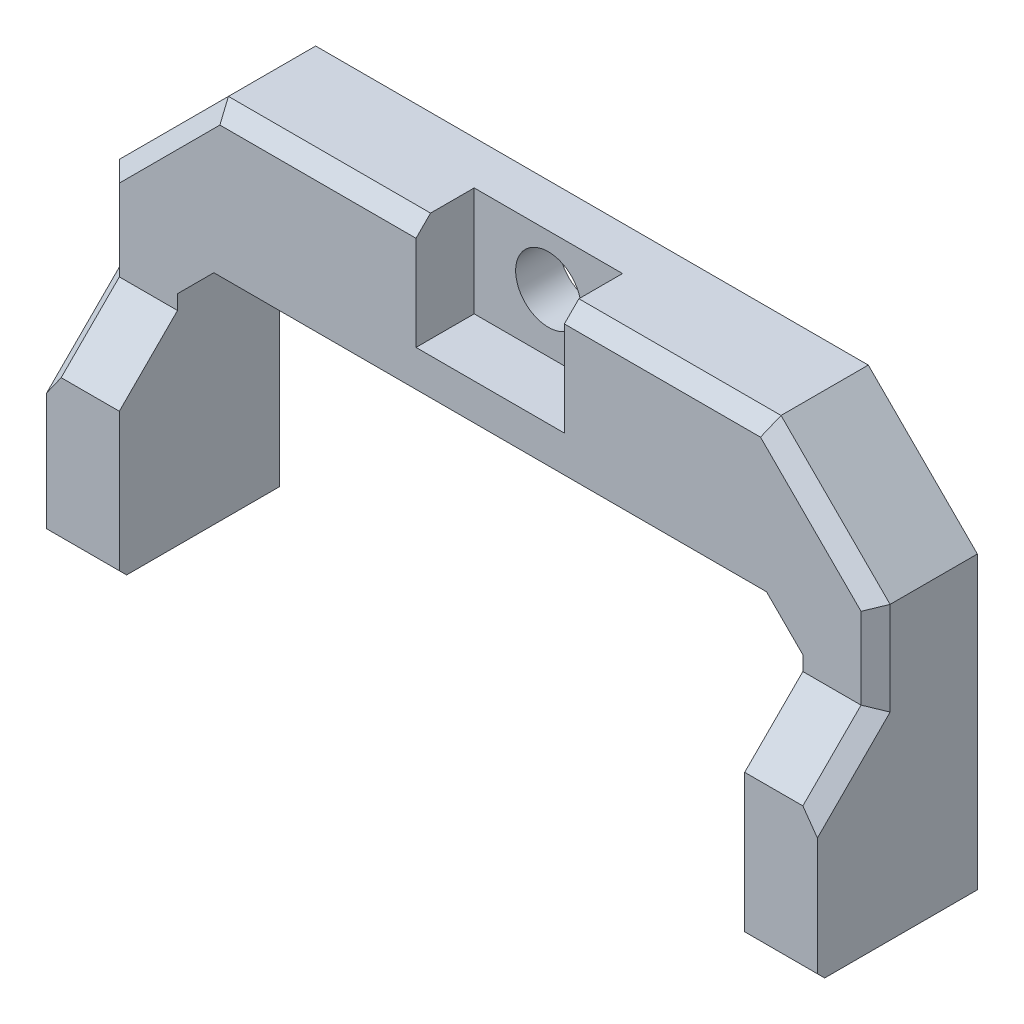
from build123d import *

# Parameters (mm, degrees)
BOSS_EXTRUDE1_DEPTH  = 7
SKETCH6_W            = 5
SKETCH6_H            = 10
BOSS_EXTRUDE2_DEPTH  = 4
SKETCH3_W            = 5.1
SKETCH3_H            = 7.5
CUT_EXTRUDE1_DEPTH   = 4
M4_CLEARANCE_HOLE1_D = 4.5
CHAMFER2_SIZE        = 4
CHAMFER5_SIZE        = 0.5


# Some blends are built 0.0001 mm under size
with BuildPart() as part:
    # Sketch1 → Boss-Extrude1 (new body)
    with BuildSketch(Plane.XY):
        Polygon((0, 0), (0, -10), (-19, -10), (-21.5, -12.5), (-21.5, -27.5), (-26.5, -27.5), (-26.5, -7.5), (-19, 0), align=None)
    boss_extrude1 = extrude(amount=BOSS_EXTRUDE1_DEPTH)

    # Sketch6 → Boss-Extrude2 (add)
    with BuildSketch(Plane.XY.offset(7)):
        with Locations((-24, -22.5)):
            Rectangle(SKETCH6_W, SKETCH6_H)
    boss_extrude2 = extrude(amount=BOSS_EXTRUDE2_DEPTH)

    # Sketch3 → Cut-Extrude1 (cut)
    with BuildSketch(Plane.XY.offset(7)):
        with Locations((-2.55, -3.75)):
            Rectangle(SKETCH3_W, SKETCH3_H)
    cut_extrude1 = extrude(amount=-CUT_EXTRUDE1_DEPTH, mode=Mode.SUBTRACT)

    # Mirror1: Boss-Extrude1, Boss-Extrude2, Cut-Extrude1 across plane
    add(boss_extrude1.mirror(Plane(origin=(0, 0, 7), x_dir=(0, 0, 1), z_dir=(-1, 0, 0))))
    add(boss_extrude2.mirror(Plane(origin=(0, 0, 7), x_dir=(0, 0, 1), z_dir=(-1, 0, 0))))
    add(cut_extrude1.mirror(Plane(origin=(0, 0, 7), x_dir=(0, 0, 1), z_dir=(-1, 0, 0))), mode=Mode.SUBTRACT)

    # M4 Clearance Hole1 (through all)
    with Locations(Plane.XY.offset(3)):
        with Locations((0, -3.5)):
            Hole(M4_CLEARANCE_HOLE1_D / 2)

    # Chamfer2
    chamfer2_edges = [part.edges().sort_by_distance(p)[0] for p in [
        (-24, -17.5, 7),
        (24, -17.5, 7),
    ]]
    chamfer(chamfer2_edges, length=CHAMFER2_SIZE - 0.0001)  # a hair under: the kernel refuses the full size

    # Chamfer4
    # the kernel refuses this chamfer: 1 mm, written as the material it takes off along each edge
    with BuildSketch(Plane(origin=(26.5, -11.68164552, 5.18154552), x_dir=(-0.9996219169112968, 0.019442520806014118, 0.01944252080601436), z_dir=(0, -0.7071067811865476, 0.7071067811865476))) as chamfer4_piece_1_section:
        with BuildLine():
            Line((1.028673195, 0), (-0.056547155, 1.027117794))
            Line((-0.056547155, 1.027117794), (-0.076539593, 1.026567876))
            ThreePointArc((-0.076539593, 1.026567876), (-0.034129227, 0.51339783), (-0.019992438, -0.000549918))
            Line((-0.019992438, -0.000549918), (0.000549918, -0.019992438))
            ThreePointArc((0.000549918, -0.019992438), (0.514497665, -0.00585565), (1.029223113, -0.019992438))
            Line((1.029223113, -0.019992438), (1.028673195, 0))
        make_face()
    chamfer4_piece_1 = extrude(amount=10.800078804, mode=Mode.PRIVATE)
    chamfer4_piece_1 = split(chamfer4_piece_1, bisect_by=Plane(origin=(26.156619069, -15.715277747, 7), z_dir=(0, 0, 1)), keep=Keep.TOP, mode=Mode.PRIVATE)
    add(chamfer4_piece_1, mode=Mode.SUBTRACT)
    with BuildSketch(Plane(origin=(-26.5, -11.68164552, 5.18154552), x_dir=(0.9996219169112968, 0.019442520806013806, 0.019442520806013806), z_dir=(0, -0.7071067811865476, 0.7071067811865476))) as chamfer4_piece_2_section:
        with BuildLine():
            Line((1.028673195, 0), (-0.056547155, -1.027117794))
            Line((-0.056547155, -1.027117794), (-0.076539593, -1.026567876))
            ThreePointArc((-0.076539593, -1.026567876), (-0.034129227, -0.51339783), (-0.019992438, 0.000549918))
            Line((-0.019992438, 0.000549918), (0.000549918, 0.019992438))
            ThreePointArc((0.000549918, 0.019992438), (0.514497665, 0.00585565), (1.029223113, 0.019992438))
            Line((1.029223113, 0.019992438), (1.028673195, 0))
        make_face()
    chamfer4_piece_2 = extrude(amount=10.800078804, mode=Mode.PRIVATE)
    chamfer4_piece_2 = split(chamfer4_piece_2, bisect_by=Plane(origin=(-26.156619069, -15.715277747, 7), z_dir=(0, 0, 1)), keep=Keep.TOP, mode=Mode.PRIVATE)
    add(chamfer4_piece_2, mode=Mode.SUBTRACT)
    with BuildSketch(Plane(origin=(-28.31845448, -9.31845448, 7), x_dir=(0.7068394360706726, -0.7068394360706746, 0.027495876610586528), z_dir=(0.7071067811865485, 0.7071067811865466, 0))) as chamfer4_piece_3:
        with BuildLine():
            Line((1.028673195, 0), (-0.056547155, 1.027117794))
            Line((-0.056547155, 1.027117794), (-0.076539593, 1.026567876))
            ThreePointArc((-0.076539593, 1.026567876), (-0.034129227, 0.51339783), (-0.019992438, -0.000549918))
            Line((-0.019992438, -0.000549918), (0.000549918, -0.019992438))
            ThreePointArc((0.000549918, -0.019992438), (0.514497665, -0.00585565), (1.029223113, -0.019992438))
            Line((1.029223113, -0.019992438), (1.028673195, 0))
        make_face()
    extrude(amount=15.749967694, mode=Mode.SUBTRACT)
    with BuildSketch(Plane(origin=(-26.5, -16.071782988, 7), x_dir=(0.9996219169112968, 0, 0.02749587661058651), z_dir=(0, 1, 0))) as chamfer4_piece_4_section:
        with BuildLine():
            Line((1.028673195, 0), (-0.056547155, 1.027117794))
            Line((-0.056547155, 1.027117794), (-0.076539593, 1.026567876))
            ThreePointArc((-0.076539593, 1.026567876), (-0.034129227, 0.51339783), (-0.019992438, -0.000549918))
            Line((-0.019992438, -0.000549918), (0.000549918, -0.019992438))
            ThreePointArc((0.000549918, -0.019992438), (0.514497665, -0.00585565), (1.029223113, -0.019992438))
            Line((1.029223113, -0.019992438), (1.028673195, 0))
        make_face()
    chamfer4_piece_4 = extrude(amount=11.143465976, mode=Mode.PRIVATE)
    chamfer4_piece_4 = split(chamfer4_piece_4, bisect_by=Plane(origin=(-26.166087376, -11.115587602, 4.615487602), z_dir=(0, 0.7071067811865476, 0.7071067811865476)), keep=Keep.TOP, mode=Mode.PRIVATE)
    add(chamfer4_piece_4, mode=Mode.SUBTRACT)
    with BuildSketch(Plane(origin=(-21.571682988, 0, 7), x_dir=(0, -0.9996219169112968, 0.027495876610586494), z_dir=(1, 0, 0))) as chamfer4_piece_5:
        with BuildLine():
            Line((1.028673195, 0), (-0.056547155, 1.027117794))
            Line((-0.056547155, 1.027117794), (-0.076539593, 1.026567876))
            ThreePointArc((-0.076539593, 1.026567876), (-0.034129227, 0.51339783), (-0.019992438, -0.000549918))
            Line((-0.019992438, -0.000549918), (0.000549918, -0.019992438))
            ThreePointArc((0.000549918, -0.019992438), (0.514497665, -0.00585565), (1.029223113, -0.019992438))
            Line((1.029223113, -0.019992438), (1.028673195, 0))
        make_face()
    extrude(amount=19.043365976, mode=Mode.SUBTRACT)
    with BuildSketch(Plane(origin=(26.5, -16.071782988, 7), x_dir=(-0.9996219169112968, 0, 0.02749587661058651), z_dir=(0, 1, 0))) as chamfer4_piece_6_section:
        with BuildLine():
            Line((1.028673195, 0), (-0.056547155, -1.027117794))
            Line((-0.056547155, -1.027117794), (-0.076539593, -1.026567876))
            ThreePointArc((-0.076539593, -1.026567876), (-0.034129227, -0.51339783), (-0.019992438, 0.000549918))
            Line((-0.019992438, 0.000549918), (0.000549918, 0.019992438))
            ThreePointArc((0.000549918, 0.019992438), (0.514497665, 0.00585565), (1.029223113, 0.019992438))
            Line((1.029223113, 0.019992438), (1.028673195, 0))
        make_face()
    chamfer4_piece_6 = extrude(amount=11.143465976, mode=Mode.PRIVATE)
    chamfer4_piece_6 = split(chamfer4_piece_6, bisect_by=Plane(origin=(26.166087376, -11.115587602, 4.615487602), z_dir=(0, 0.7071067811865476, 0.7071067811865476)), keep=Keep.TOP, mode=Mode.PRIVATE)
    add(chamfer4_piece_6, mode=Mode.SUBTRACT)
    with BuildSketch(Plane(origin=(28.31845448, -9.31845448, 7), x_dir=(-0.7068394360706725, -0.7068394360706747, 0.027495876610586528), z_dir=(-0.7071067811865487, 0.7071067811865464, 0))) as chamfer4_piece_7:
        with BuildLine():
            Line((1.028673195, 0), (-0.056547155, -1.027117794))
            Line((-0.056547155, -1.027117794), (-0.076539593, -1.026567876))
            ThreePointArc((-0.076539593, -1.026567876), (-0.034129227, -0.51339783), (-0.019992438, 0.000549918))
            Line((-0.019992438, 0.000549918), (0.000549918, 0.019992438))
            ThreePointArc((0.000549918, 0.019992438), (0.514497665, 0.00585565), (1.029223113, 0.019992438))
            Line((1.029223113, 0.019992438), (1.028673195, 0))
        make_face()
    extrude(amount=15.749967694, mode=Mode.SUBTRACT)
    with BuildSketch(Plane(origin=(21.571682988, 0, 7), x_dir=(0, -0.9996219169112968, 0.027495876610586494), z_dir=(-1, 0, 0))) as chamfer4_piece_8:
        with BuildLine():
            Line((1.028673195, 0), (-0.056547155, -1.027117794))
            Line((-0.056547155, -1.027117794), (-0.076539593, -1.026567876))
            ThreePointArc((-0.076539593, -1.026567876), (-0.034129227, -0.51339783), (-0.019992438, 0.000549918))
            Line((-0.019992438, 0.000549918), (0.000549918, 0.019992438))
            ThreePointArc((0.000549918, 0.019992438), (0.514497665, 0.00585565), (1.029223113, 0.019992438))
            Line((1.029223113, 0.019992438), (1.028673195, 0))
        make_face()
    extrude(amount=19.043365976, mode=Mode.SUBTRACT)
    with BuildSketch(Plane(origin=(26.5, -16.071782988, 7), x_dir=(-0.9996219169112968, 0, 0.02749587661058651), z_dir=(0, 1, 0))) as chamfer4_piece_9a_section:
        with BuildLine():
            Line((1.028673195, 0), (-0.056547155, -1.027117794))
            Line((-0.056547155, -1.027117794), (-0.076539593, -1.026567876))
            ThreePointArc((-0.076539593, -1.026567876), (-0.034129227, -0.51339783), (-0.019992438, 0.000549918))
            Line((-0.019992438, 0.000549918), (0.000549918, 0.019992438))
            ThreePointArc((0.000549918, 0.019992438), (0.514497665, 0.00585565), (1.029223113, 0.019992438))
            Line((1.029223113, 0.019992438), (1.028673195, 0))
        make_face()
    chamfer4_piece_9a = extrude(amount=11.143465976, mode=Mode.PRIVATE)
    chamfer4_piece_9a = split(chamfer4_piece_9a, bisect_by=Plane(origin=(26.181906875, -13.879260813, 7.379160813), z_dir=(0, -0.7071067811865476, -0.7071067811865476)), keep=Keep.TOP, mode=Mode.PRIVATE)
    with BuildSketch(Plane(origin=(26.5, -11.68164552, 5.18154552), x_dir=(-0.9996219169112968, 0.019442520806014118, 0.01944252080601436), z_dir=(0, -0.7071067811865476, 0.7071067811865476))) as chamfer4_piece_9b_section:
        with BuildLine():
            Line((1.028673195, 0), (-0.056547155, 1.027117794))
            Line((-0.056547155, 1.027117794), (-0.076539593, 1.026567876))
            ThreePointArc((-0.076539593, 1.026567876), (-0.034129227, 0.51339783), (-0.019992438, -0.000549918))
            Line((-0.019992438, -0.000549918), (0.000549918, -0.019992438))
            ThreePointArc((0.000549918, -0.019992438), (0.514497665, -0.00585565), (1.029223113, -0.019992438))
            Line((1.029223113, -0.019992438), (1.028673195, 0))
        make_face()
    chamfer4_piece_9b = extrude(amount=10.800078804, mode=Mode.PRIVATE)
    chamfer4_piece_9b = split(chamfer4_piece_9b, bisect_by=Plane(origin=(26.181906875, -12.963885635, 7), z_dir=(0, 0, -1)), keep=Keep.TOP, mode=Mode.PRIVATE)
    chamfer4_piece_9 = chamfer4_piece_9a & chamfer4_piece_9b
    add(chamfer4_piece_9, mode=Mode.SUBTRACT)
    with BuildSketch(Plane(origin=(-26.5, -16.071782988, 7), x_dir=(0.9996219169112968, 0, 0.02749587661058651), z_dir=(0, 1, 0))) as chamfer4_piece_10a_section:
        with BuildLine():
            Line((1.028673195, 0), (-0.056547155, 1.027117794))
            Line((-0.056547155, 1.027117794), (-0.076539593, 1.026567876))
            ThreePointArc((-0.076539593, 1.026567876), (-0.034129227, 0.51339783), (-0.019992438, -0.000549918))
            Line((-0.019992438, -0.000549918), (0.000549918, -0.019992438))
            ThreePointArc((0.000549918, -0.019992438), (0.514497665, -0.00585565), (1.029223113, -0.019992438))
            Line((1.029223113, -0.019992438), (1.028673195, 0))
        make_face()
    chamfer4_piece_10a = extrude(amount=11.143465976, mode=Mode.PRIVATE)
    chamfer4_piece_10a = split(chamfer4_piece_10a, bisect_by=Plane(origin=(-26.181906875, -13.879260813, 7.379160813), z_dir=(0, -0.7071067811865476, -0.7071067811865476)), keep=Keep.TOP, mode=Mode.PRIVATE)
    with BuildSketch(Plane(origin=(-26.5, -11.68164552, 5.18154552), x_dir=(0.9996219169112968, 0.019442520806013806, 0.019442520806013806), z_dir=(0, -0.7071067811865476, 0.7071067811865476))) as chamfer4_piece_10b_section:
        with BuildLine():
            Line((1.028673195, 0), (-0.056547155, -1.027117794))
            Line((-0.056547155, -1.027117794), (-0.076539593, -1.026567876))
            ThreePointArc((-0.076539593, -1.026567876), (-0.034129227, -0.51339783), (-0.019992438, 0.000549918))
            Line((-0.019992438, 0.000549918), (0.000549918, 0.019992438))
            ThreePointArc((0.000549918, 0.019992438), (0.514497665, 0.00585565), (1.029223113, 0.019992438))
            Line((1.029223113, 0.019992438), (1.028673195, 0))
        make_face()
    chamfer4_piece_10b = extrude(amount=10.800078804, mode=Mode.PRIVATE)
    chamfer4_piece_10b = split(chamfer4_piece_10b, bisect_by=Plane(origin=(-26.181906875, -12.963885635, 7), z_dir=(0, 0, -1)), keep=Keep.TOP, mode=Mode.PRIVATE)
    chamfer4_piece_10 = chamfer4_piece_10a & chamfer4_piece_10b
    add(chamfer4_piece_10, mode=Mode.SUBTRACT)

    # Chamfer5
    chamfer5_edges = [part.edges().sort_by_distance(p)[0] for p in [
        (-24, -27.5, 11),
        (24, -27.5, 11),
    ]]
    chamfer(chamfer5_edges, length=CHAMFER5_SIZE)


solid = part.part
